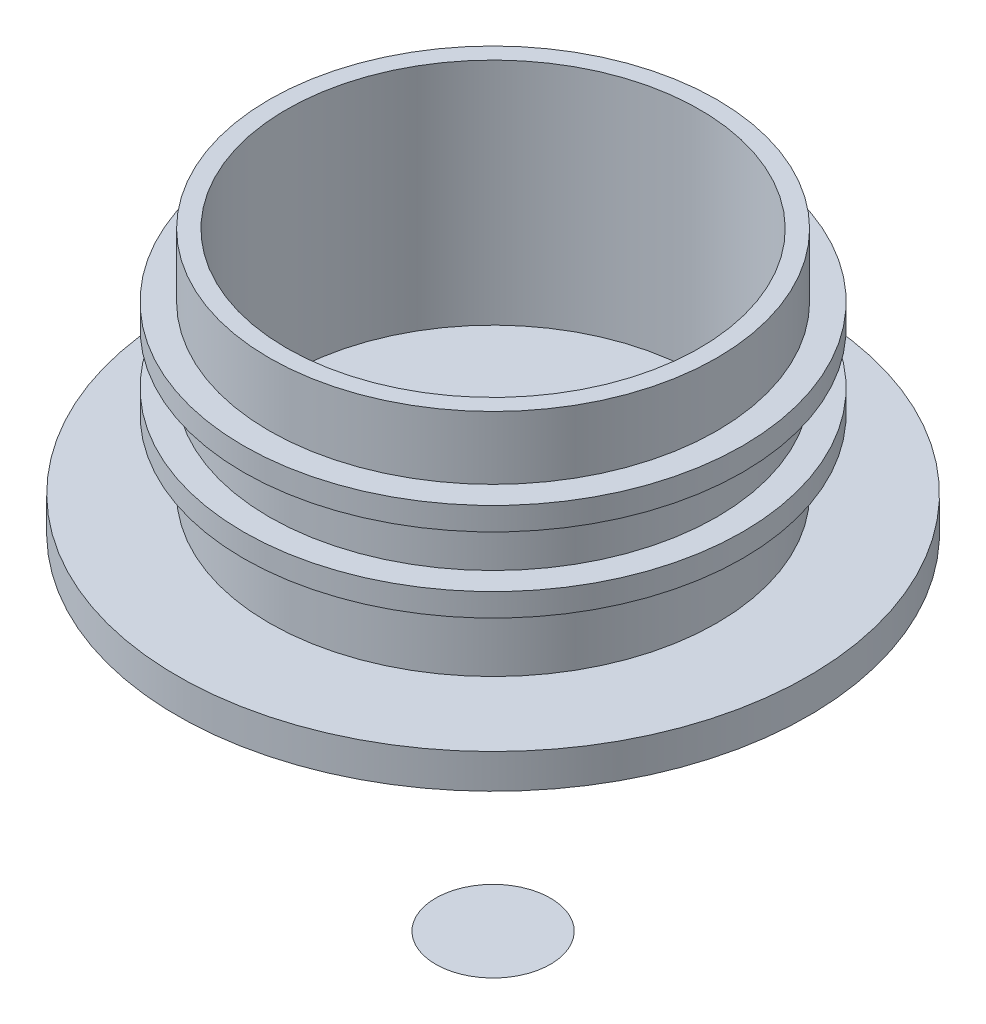
from build123d import *

# Parameters (mm, degrees)
SKETCH_1_R          = 19.5
SKETCH_1_R_2        = 18
EXTRUDE_1_DEPTH     = 20
SKETCH_3_R          = 27.5
EXTRUDE_2_DEPTH     = 3
SKETCH_4_R          = 21.75
EXTRUDE_3_DEPTH     = 2
EXTRUDE_START       = 3
SKETCH_8_R          = 21.75
EXTRUDE_4_DEPTH     = 2
SKETCH_6_R          = 18
CUT_EXTRUDE_1_DEPTH = 35


with BuildPart() as part:
    # 草圖1 → 填料-伸長1 (new body)
    with BuildSketch(Plane(origin=(0, 0, 0), x_dir=(1, 0, 0), z_dir=(0, 1, 0))):
        Circle(SKETCH_1_R)
        Circle(SKETCH_1_R_2, mode=Mode.SUBTRACT)
    extrude(amount=EXTRUDE_1_DEPTH)

    # 草圖3 → 填料-伸長2 (add)
    with BuildSketch(Plane.XZ):
        Circle(SKETCH_3_R)
    extrude(amount=EXTRUDE_2_DEPTH)

    # 草圖4 → 填料-伸長3 (add)
    with BuildSketch(Plane(origin=(0, 8, 0), x_dir=(1, 0, 0), z_dir=(0, 1, 0))):
        Circle(SKETCH_4_R)
    extrude(amount=-EXTRUDE_3_DEPTH)

    # 草圖8 → 填料-伸長4 (add)
    with BuildSketch(Plane(origin=(0, 11.5, 0), x_dir=(1, 0, 0), z_dir=(0, 1, 0)).offset(EXTRUDE_START)):
        Circle(SKETCH_8_R)
    extrude(amount=-EXTRUDE_4_DEPTH)

    # 草圖6 → 除料-伸長1 (cut)
    with BuildSketch(Plane(origin=(0, 0, 0), x_dir=(1, 0, 0), z_dir=(0, 1, 0))):
        Circle(SKETCH_6_R)
    extrude(amount=CUT_EXTRUDE_1_DEPTH, mode=Mode.SUBTRACT)


with BuildPart() as body_2:
    # 草圖15 → 旋轉10 (revolve)
    with BuildSketch(Plane(origin=(0, 0, 0), x_dir=(0, 0, -1), z_dir=(1, 0, 0))):
        with BuildLine():
            Line((-5, -33), (0, -33))
            Line((0, -33), (0, -34.975323557))
            ThreePointArc((0, -34.975323557), (-2.615059839, -34.278904796), (-5, -33))
        make_face()
    revolve(axis=Axis((0, -27.321248383, 0), (0, -1, 0)))


solid = Compound([part.part, body_2.part])
